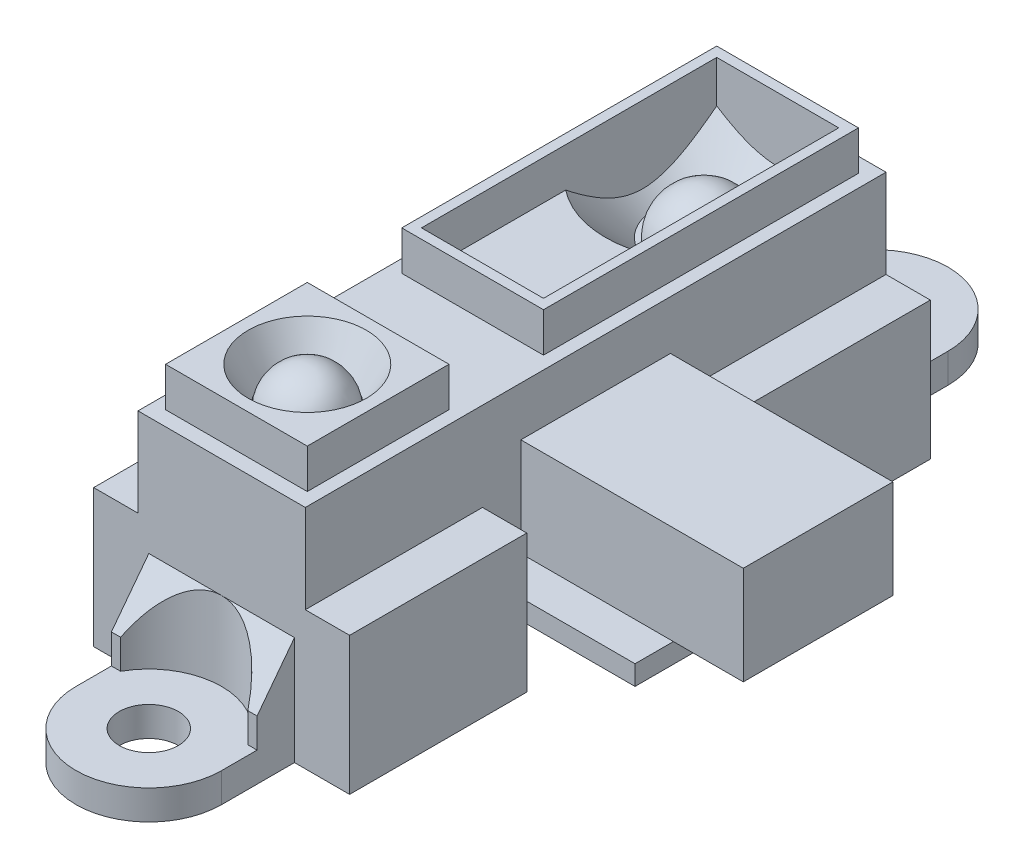
from build123d import *

# Parameters (mm, degrees)
SKETCH_1_W          = 13
SKETCH_1_H          = 29.5
EXTRUDE_1_DEPTH     = 7
EXTRUDE_2_DEPTH     = 4.5
SKETCH_3_W          = 7.2
SKETCH_3_H          = 7.2
SKETCH_3_R          = 2
SKETCH_3_H_2        = 16
SKETCH_3_W_2        = 6.2
SKETCH_3_H_3        = 15
EXTRUDE_3_DEPTH     = 2
CHAMFER_1_SIZE      = 1
CHAMFER_1_SIZE2     = 1.732050808
EXTRUDE_4_DEPTH     = 2
SKETCH_8_R          = 1.5
EXTRUDE_5_DEPTH     = 5.5
CUT_EXTRUDE_1_DEPTH = 35.949964235
SKETCH_10_R         = 3.7
CUT_EXTRUDE_2_DEPTH = 5.5
CUT_EXTRUDE_3_DEPTH = 3
CUT_EXTRUDE_4_DEPTH = 41.507530164
EXTRUDE_6_DEPTH     = 1
SKETCH_14_W         = 11.3
SKETCH_14_H         = 7.6
EXTRUDE_7_DEPTH     = 5


with BuildPart() as part:
    # Эскиз1 → Бобышка-Вытянуть1 (new body)
    with BuildSketch(Plane(origin=(0, 0, 0), x_dir=(1, 0, 0), z_dir=(0, 1, 0))):
        with Locations((6.5, 14.75)):
            Rectangle(SKETCH_1_W, SKETCH_1_H)
    extrude_1 = extrude(amount=EXTRUDE_1_DEPTH)

    # Эскиз2 → Бобышка-Вытянуть2 (add)
    with BuildSketch(Plane(origin=(0, 7, 0), x_dir=(1, 0, 0), z_dir=(0, 1, 0))):
        Polygon((6.5, 29.5), (10.75, 29.5), (10.75, 0), (2.25, 0), (2.25, 29.5), align=None)
    extrude(amount=EXTRUDE_2_DEPTH)

    # Эскиз5 → Вырез-Повернуть2 (revolve, cut)
    with BuildSketch(Plane(origin=(6.5, 0, 0), x_dir=(0, 0, -1), z_dir=(1, 0, 0))):
        with BuildLine():
            Line((29.5, 11.5), (24.5, 11.5))
            Line((24.5, 11.5), (24.5, 11.25))
            ThreePointArc((24.5, 11.25), (26.090990258, 10.590990258), (26.75, 9))
            Line((26.75, 9), (27, 9))
            Line((27, 9), (29.5, 11.5))
        make_face()
    revolve(axis=Axis((6.5, 11.5, -24.5), (0, -1, 0)), mode=Mode.SUBTRACT)

    # Эскиз3 → Бобышка-Вытянуть3 (add)
    # profile 1 of 2: a face of its own
    with BuildSketch(Plane(origin=(0, 11.5, 0), x_dir=(1, 0, 0), z_dir=(0, 1, 0))):
        with Locations((6.5, 4.35)):
            Rectangle(SKETCH_3_W, SKETCH_3_H)
        with Locations((6.5, 4.35)):
            Circle(SKETCH_3_R, mode=Mode.SUBTRACT)
    # profile 2 of 2: a face of its own
    with BuildSketch(Plane(origin=(0, 11.5, 0), x_dir=(1, 0, 0), z_dir=(0, 1, 0))):
        with Locations((6.5, 20.75)):
            Rectangle(SKETCH_3_W, SKETCH_3_H_2)
        with Locations((6.5, 20.75)):
            Rectangle(SKETCH_3_W_2, SKETCH_3_H_3, mode=Mode.SUBTRACT)
    extrude(amount=EXTRUDE_3_DEPTH)

    # Эскиз4 → Повернуть1 (revolve)
    with BuildSketch(Plane(origin=(0, 11.5, 0), x_dir=(1, 0, 0), z_dir=(0, 1, 0))):
        with BuildLine():
            Line((4.5, 4.35), (6.5, 4.35))
            Line((6.5, 4.35), (8.5, 4.35))
            ThreePointArc((8.5, 4.35), (6.5, 6.35), (4.5, 4.35))
        make_face()
    revolve(axis=Axis((6.5, 11.5, -4.35), (1, 0, 0)))

    # Фаска1
    chamfer_1_edges = [part.edges().sort_by_distance(p)[0] for p in [
        (4.5, 13.5, -4.35),
    ]]
    chamfer_1_side = [part.faces().sort_by_distance(p)[0] for p in [
        (6.5, 13.5, -0.851823376),
    ]]
    chamfer(chamfer_1_edges, length=CHAMFER_1_SIZE, length2=CHAMFER_1_SIZE2, reference=chamfer_1_side[0])

    # Эскиз7 → Бобышка-Вытянуть4 (add)
    with BuildSketch(Plane(origin=(0, 11.5, 0), x_dir=(1, 0, 0), z_dir=(0, 1, 0))):
        Polygon((2.25, 29.5), (10.75, 29.5), (10.75, 28.25), (10.75, 20.186921916), (9.6, 20.186921916), (9.6, 28.25), (3.4, 28.25), (3.4, 20.186921916), (2.25, 20.186921916), (2.25, 28.25), align=None)
    extrude(amount=-EXTRUDE_4_DEPTH)

    # Эскиз8 → Бобышка-Вытянуть5 (add)
    with BuildSketch(Plane(origin=(0, 0, 0), x_dir=(-1, 0, 0), z_dir=(0, -1, 0))):
        with BuildLine():
            Line((-2.8, -3.7), (-2.8, 0))
            Line((-2.8, 0), (-10.2, 0))
            Line((-10.2, 0), (-10.2, -3.7))
            ThreePointArc((-10.2, -3.7), (-6.5, -7.4), (-2.8, -3.7))
        make_face()
        with Locations((-6.5, -3.7)):
            Circle(SKETCH_8_R, mode=Mode.SUBTRACT)
    extrude_5 = extrude(amount=-EXTRUDE_5_DEPTH)

    # Эскиз9 → Вырез-Вытянуть1 (cut, through all)
    with BuildSketch(Plane.ZY):
        Polygon((7.4, 8.09796148), (0, 5.5), (1.9, 3), (1.9, 1.5), (7.4, 1.5), (10.785462846, 4.144098561), align=None)
    cut_extrude_1 = extrude(amount=-CUT_EXTRUDE_1_DEPTH, mode=Mode.SUBTRACT)

    # Эскиз10 → Вырез-Вытянуть2 (cut)
    with BuildSketch(Plane(origin=(0, 1.5, 0), x_dir=(1, 0, 0), z_dir=(0, 1, 0))):
        with Locations((6.5, -3.7)):
            Circle(SKETCH_10_R)
    cut_extrude_2 = extrude(amount=CUT_EXTRUDE_2_DEPTH, mode=Mode.SUBTRACT)

    # Зеркальное отражение1: Бобышка-Вытянуть1, Бобышка-Вытянуть5, Вырез-Вытянуть1, Вырез-Вытянуть2 across plane
    add(extrude_1.mirror(Plane(origin=(0, 0, -14.75), x_dir=(1, 0, 0), z_dir=(0, 0, -1))))
    add(extrude_5.mirror(Plane(origin=(0, 0, -14.75), x_dir=(1, 0, 0), z_dir=(0, 0, -1))))
    add(cut_extrude_1.mirror(Plane(origin=(0, 0, -14.75), x_dir=(1, 0, 0), z_dir=(0, 0, -1))), mode=Mode.SUBTRACT)
    add(cut_extrude_2.mirror(Plane(origin=(0, 0, -14.75), x_dir=(1, 0, 0), z_dir=(0, 0, -1))), mode=Mode.SUBTRACT)

    # Эскиз11 → Вырез-Вытянуть3 (cut)
    with BuildSketch(Plane(origin=(0, 0, 0), x_dir=(-1, 0, 0), z_dir=(0, -1, 0))):
        Polygon((-12.5, 9), (-12.5, 0.5), (-0.5, 0.5), (-0.5, 29), (-12.5, 29), (-12.5, 20.5), (-15.183114384, 20.5), (-15.183114384, 9), align=None)
    extrude(amount=-CUT_EXTRUDE_3_DEPTH, mode=Mode.SUBTRACT)

    # Эскиз12 → Вырез-Вытянуть4 (cut, through all)
    with BuildSketch(Plane(origin=(0, 3, 0), x_dir=(-1, 0, 0), z_dir=(0, -1, 0))):
        Polygon((-13, 20.5), (-13, 9), (-12.5, 9), (-10.75, 9), (-10.75, 20.5), (-12.5, 20.5), align=None)
    extrude(amount=-CUT_EXTRUDE_4_DEPTH, mode=Mode.SUBTRACT)

    # Эскиз13 → Бобышка-Вытянуть6 (add)
    with BuildSketch(Plane(origin=(0, 3, 0), x_dir=(-1, 0, 0), z_dir=(0, -1, 0))):
        Polygon((-10.75, 9), (-10.75, 20.5), (-13, 20.5), (-18.5, 20.5), (-18.5, 9), align=None)
    extrude(amount=-EXTRUDE_6_DEPTH)

    # Эскиз14 → Бобышка-Вытянуть7 (add)
    with BuildSketch(Plane(origin=(0, 4, 0), x_dir=(1, 0, 0), z_dir=(0, 1, 0))):
        with Locations((16.4, 14.75)):
            Rectangle(SKETCH_14_W, SKETCH_14_H)
    extrude(amount=EXTRUDE_7_DEPTH)


solid = part.part
